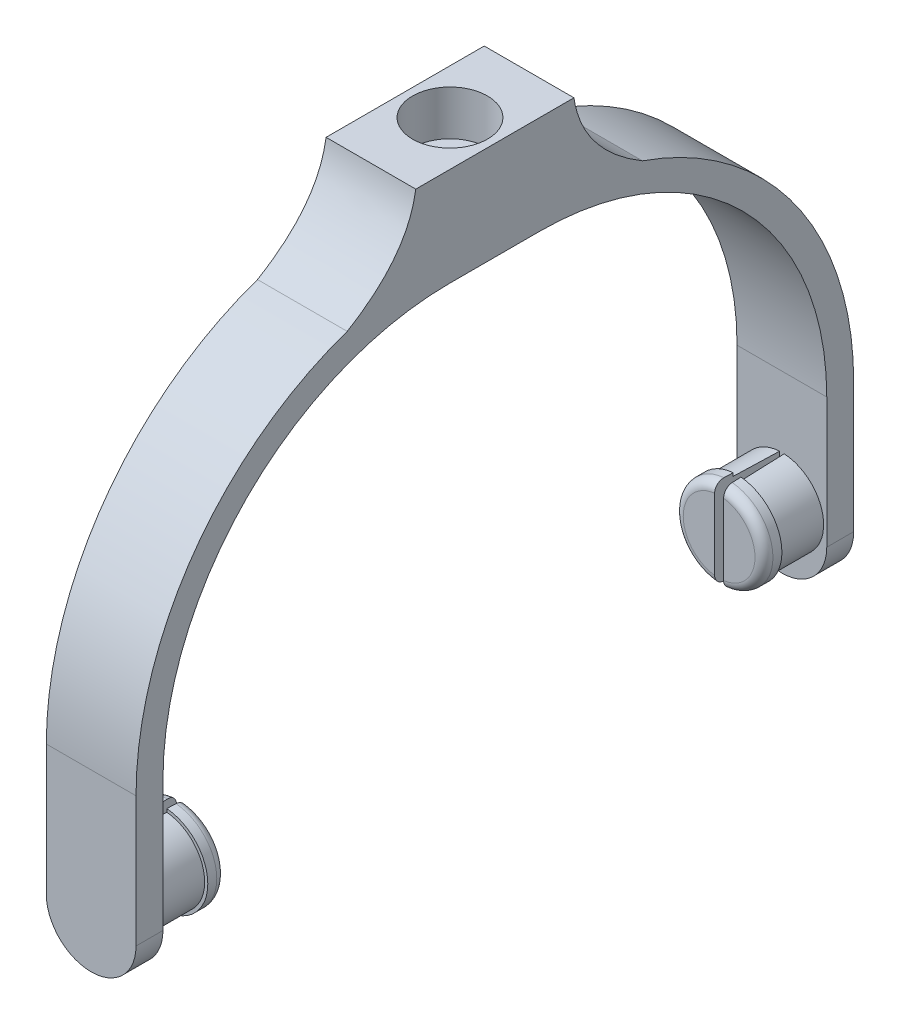
from build123d import *

# Parameters (mm, degrees)
BOSS_EXTRUDE1_DEPTH  = 10
FILLET1_R            = 5
SKETCH6_R            = 4.65
BOSS_EXTRUDE2_DEPTH  = 5
SKETCH7_R            = 5
BOSS_EXTRUDE3_DEPTH  = 2
FILLET2_R            = 1
FILLET2_OF_MIRROR1_R = 1
BOSS_EXTRUDE4_START  = -10
BOSS_EXTRUDE4_DEPTH  = 10
SKETCH9_R            = 4.175
CUT_EXTRUDE1_DEPTH   = 5
SKETCH10_R           = 1.175
CUT_EXTRUDE2_DEPTH   = 71.738227722
SKETCH12_W           = 1
SKETCH12_H           = 12
CUT_EXTRUDE3_DEPTH   = 7
CUT_EXTRUDE3_DRAFT   = -2
SKETCH13_W           = 1
SKETCH13_H           = 12
CUT_EXTRUDE4_DEPTH   = 7
CUT_EXTRUDE4_DRAFT   = -2


with BuildPart() as part:
    # Sketch3 → Boss-Extrude1 (new body)
    with BuildSketch(Plane(origin=(0, 0, 0), x_dir=(0, 0, -1), z_dir=(1, 0, 0))):
        with BuildLine():
            Line((-37, -7), (-37, 12.5))
            ThreePointArc((-37, 12.5), (-27.627416998, 35.127416998), (-5, 44.5))
            Line((-5, 44.5), (5, 44.5))
            ThreePointArc((5, 44.5), (27.627416998, 35.127416998), (37, 12.5))
            Line((37, 12.5), (37, -7))
            Line((37, -7), (40, -7))
            Line((40, -7), (40, 12.5))
            ThreePointArc((40, 12.5), (29.748737342, 37.248737342), (5, 47.5))
            Line((5, 47.5), (-5, 47.5))
            ThreePointArc((-5, 47.5), (-29.748737342, 37.248737342), (-40, 12.5))
            Line((-40, 12.5), (-40, -7))
            Line((-40, -7), (-37, -7))
        make_face()
    extrude(amount=BOSS_EXTRUDE1_DEPTH)

    # Fillet1
    fillet1_edges = [part.edges().sort_by_distance(p)[0] for p in [
        (10, -7, -38.5),
        (0, -7, -38.5),
        (0, -7, 38.5),
        (10, -7, 38.5),
    ]]
    fillet(fillet1_edges, radius=FILLET1_R - 0.0001)  # a hair under: the kernel refuses the full size

    # Sketch6 → Boss-Extrude2 (add)
    with BuildSketch(Plane(origin=(0, 0, 37), x_dir=(-1, 0, 0), z_dir=(0, 0, -1))):
        with Locations(Location((-5, 0, 0), (0, 0, 270))):
            Circle(SKETCH6_R)
    boss_extrude2 = extrude(amount=BOSS_EXTRUDE2_DEPTH)

    # Sketch7 → Boss-Extrude3 (add)
    with BuildSketch(Plane(origin=(0, 0, 32), x_dir=(-1, 0, 0), z_dir=(0, 0, -1))):
        with Locations(Location((-5, 0, 0), (0, 0, 90))):
            Circle(SKETCH7_R)
    boss_extrude3 = extrude(amount=BOSS_EXTRUDE3_DEPTH)

    # Fillet2
    fillet2_edges = [part.edges().sort_by_distance(p)[0] for p in [
        (5, -5, 30),
    ]]
    fillet(fillet2_edges, radius=FILLET2_R)

    # Mirror1: Boss-Extrude2, Boss-Extrude3 across plane
    add(boss_extrude2.mirror(Plane.XY))
    add(boss_extrude3.mirror(Plane.XY))

    # Fillet2 of Mirror1
    fillet2_of_mirror1_edges = [part.edges().sort_by_distance(p)[0] for p in [
        (5, -5, -30),
    ]]
    fillet(fillet2_of_mirror1_edges, radius=FILLET2_OF_MIRROR1_R)

    # Sketch8 → Boss-Extrude4 (add)
    with BuildSketch(Plane(origin=(10, 0, 0), x_dir=(0, 0, -1), z_dir=(1, 0, 0)).offset(BOSS_EXTRUDE4_START)):
        with BuildLine():
            Line((8.815238473, 55.479534195), (-8.815238473, 55.479534195))
            add(Edge.make_bspline(
                [(-16.460806571, 45.570378177), (-9.68931269, 49.59059719), (-8.815238473, 55.479534195)],
                knots=[0, 0, 0, 1, 1, 1], degree=2))
            ThreePointArc((-16.460806571, 45.570378177), (-10.811056867, 47.014223417), (-5, 47.5))
            Line((-5, 47.5), (5, 47.5))
            ThreePointArc((5, 47.5), (10.811056867, 47.014223417), (16.460806571, 45.570378177))
            add(Edge.make_bspline(
                [(16.460806571, 45.570378177), (9.68931269, 49.59059719), (8.815238473, 55.479534195)],
                knots=[0, 0, 0, 1, 1, 1], degree=2))
        make_face()
    extrude(amount=BOSS_EXTRUDE4_DEPTH)

    # Sketch9 → Cut-Extrude1 (cut)
    with BuildSketch(Plane(origin=(0, 55.479534195, 0), x_dir=(1, 0, 0), z_dir=(0, 1, 0))):
        with Locations(Location((5, 0, 0), (0, 0, 270))):
            Circle(SKETCH9_R)
    extrude(amount=-CUT_EXTRUDE1_DEPTH, mode=Mode.SUBTRACT)

    # Sketch10 → Cut-Extrude2 (cut, through all)
    with BuildSketch(Plane(origin=(0, 50.479534195, 0), x_dir=(1, 0, 0), z_dir=(0, 1, 0))):
        with Locations(Location((5, 0, 0), (0, 0, 270))):
            Circle(SKETCH10_R)
    extrude(amount=-CUT_EXTRUDE2_DEPTH, mode=Mode.SUBTRACT)


with BuildPart() as cut_extrude3_tool:
    # Sketch12 → Cut-Extrude3 (with draft: the straight prism first)
    with BuildSketch(Plane(origin=(0, 0, 30), x_dir=(-1, 0, 0), z_dir=(0, 0, -1))):
        with Locations((-5, 0)):
            Rectangle(SKETCH12_W, SKETCH12_H)
    extrude(amount=-CUT_EXTRUDE3_DEPTH)
    # Cut-Extrude3: the draft: its side faces are tilted about the plane it starts from
    cut_extrude3_sides = [cut_extrude3_tool.faces().sort_by_distance(p)[0] for p in [
        (4.5, 0, 33.5),
        (5, 6, 33.5),
        (5.5, 0, 33.5),
        (5, -6, 33.5),
    ]]
    draft(cut_extrude3_sides, Plane(origin=(0, 0, 30), x_dir=(-1, 0, 0), z_dir=(0, 0, -1)), CUT_EXTRUDE3_DRAFT)


with BuildPart() as part_1:
    add(part.part)

    # Cut-Extrude3: cut by cut_extrude3_tool
    add(cut_extrude3_tool.part, mode=Mode.SUBTRACT)


with BuildPart() as cut_extrude4_tool:
    # Sketch13 → Cut-Extrude4 (with draft: the straight prism first)
    with BuildSketch(Plane.XY.offset(-30)):
        with Locations((5, 0)):
            Rectangle(SKETCH13_W, SKETCH13_H)
    extrude(amount=-CUT_EXTRUDE4_DEPTH)
    # Cut-Extrude4: the draft: its side faces are tilted about the plane it starts from
    cut_extrude4_sides = [cut_extrude4_tool.faces().sort_by_distance(p)[0] for p in [
        (5, -6, -33.5),
        (5.5, 0, -33.5),
        (5, 6, -33.5),
        (4.5, 0, -33.5),
    ]]
    draft(cut_extrude4_sides, Plane.XY.offset(-30), CUT_EXTRUDE4_DRAFT)


with BuildPart() as part_2:
    add(part_1.part)

    # Cut-Extrude4: cut by cut_extrude4_tool
    add(cut_extrude4_tool.part, mode=Mode.SUBTRACT)


solid = part_2.part
